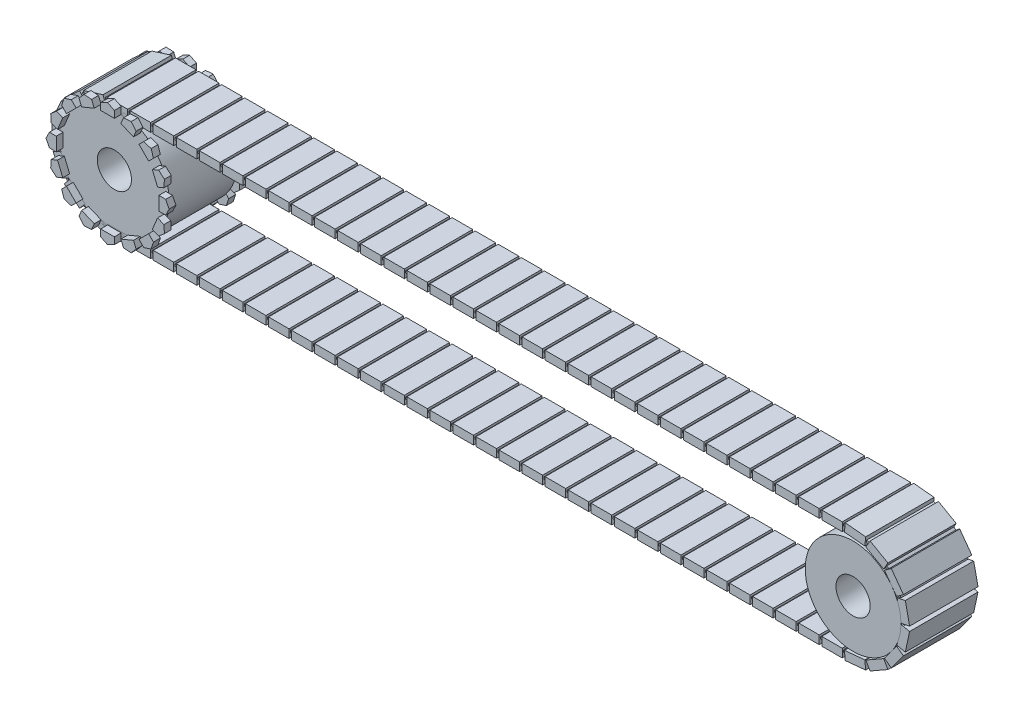
from build123d import *

# Parameters (mm, degrees)
SKETCH1_R             = 40
BOSS_EXTRUDE1_DEPTH   = 50
SKETCH1_R_2           = 35
BOSS_EXTRUDE1_2_DEPTH = 50
BOSS_EXTRUDE2_DEPTH   = 5
CIRPATTERN1_COUNT     = 16
MIRROR1_COPY_1_DEPTH  = 5
MIRROR1_COPY_2_DEPTH  = 5
MIRROR1_COPY_3_DEPTH  = 5
MIRROR1_COPY_4_DEPTH  = 5
MIRROR1_COPY_5_DEPTH  = 5
MIRROR1_COPY_6_DEPTH  = 5
MIRROR1_COPY_7_DEPTH  = 5
MIRROR1_COPY_8_DEPTH  = 5
MIRROR1_COPY_9_DEPTH  = 5
MIRROR1_COPY_10_DEPTH = 5
MIRROR1_COPY_11_DEPTH = 5
MIRROR1_COPY_12_DEPTH = 5
MIRROR1_COPY_13_DEPTH = 5
MIRROR1_COPY_14_DEPTH = 5
MIRROR1_COPY_15_DEPTH = 5
SKETCH10_W            = 6.209415886
SKETCH10_H            = 15
BOSS_EXTRUDE3_DEPTH   = 50
CRVPATTERN3_OUTLINE_W = 15
CRVPATTERN3_OUTLINE_H = 6.209415886
CRVPATTERN3_DEPTH     = 50
BOSS_EXTRUDE4_DEPTH   = 49
CRVPATTERN4_DEPTH     = 49
SKETCH12_R            = 12.5
CUT_EXTRUDE1_DEPTH    = 586.652227204
SKETCH14_R            = 12.5
CUT_EXTRUDE2_DEPTH    = 586.652227204


# Read off the part's stored shape, not the designer's step: CrvPattern3, CrvPattern4
with BuildPart() as part:
    # Sketch1 → Boss-Extrude1 (new body)
    with BuildSketch(Plane.XY):
        Circle(SKETCH1_R)
    extrude(amount=BOSS_EXTRUDE1_DEPTH)

    # Sketch2 → Boss-Extrude2 (add)
    with BuildSketch(Plane.XY.offset(50)):
        Polygon((5, 37.5), (-5, 37.5), (-5, 42.5), (0, 45), (5, 42.5), align=None)
    boss_extrude2 = extrude(amount=BOSS_EXTRUDE2_DEPTH)

    # CirPattern1: Boss-Extrude2 ×16 about axis
    cirpattern1_axis = Axis((0, 0, 0), (0, 0, 1))
    for i in range(1, CIRPATTERN1_COUNT):
        add(boss_extrude2.rotate(cirpattern1_axis, i * 360 / CIRPATTERN1_COUNT))

    # Mirror1: Boss-Extrude2 across plane
    add(boss_extrude2.mirror(Plane.XY.offset(25)))

    # Mirror1 copy 1 sketch → Mirror1 copy 1 (add)
    with BuildSketch(Plane(origin=(0, 0, 0), x_dir=(0.9238795325112867, 0.3826834323650898, 0), z_dir=(0, 0, -1))):
        Polygon((5, -37.5), (-5, -37.5), (-5, -42.5), (0, -45), (5, -42.5), align=None)
    extrude(amount=MIRROR1_COPY_1_DEPTH)

    # Mirror1 copy 2 sketch → Mirror1 copy 2 (add)
    with BuildSketch(Plane(origin=(0, 0, 0), x_dir=(0.7071067811865476, 0.7071067811865475, 0), z_dir=(0, 0, -1))):
        Polygon((5, -37.5), (-5, -37.5), (-5, -42.5), (0, -45), (5, -42.5), align=None)
    extrude(amount=MIRROR1_COPY_2_DEPTH)

    # Mirror1 copy 3 sketch → Mirror1 copy 3 (add)
    with BuildSketch(Plane(origin=(0, 0, 0), x_dir=(0.38268343236508984, 0.9238795325112867, 0), z_dir=(0, 0, -1))):
        Polygon((5, -37.5), (-5, -37.5), (-5, -42.5), (0, -45), (5, -42.5), align=None)
    extrude(amount=MIRROR1_COPY_3_DEPTH)

    # Mirror1 copy 4 sketch → Mirror1 copy 4 (add)
    with BuildSketch(Plane.YX):
        Polygon((5, -37.5), (-5, -37.5), (-5, -42.5), (0, -45), (5, -42.5), align=None)
    extrude(amount=MIRROR1_COPY_4_DEPTH)

    # Mirror1 copy 5 sketch → Mirror1 copy 5 (add)
    with BuildSketch(Plane(origin=(0, 0, 0), x_dir=(-0.3826834323650897, 0.9238795325112867, 0), z_dir=(0, 0, -1))):
        Polygon((5, -37.5), (-5, -37.5), (-5, -42.5), (0, -45), (5, -42.5), align=None)
    extrude(amount=MIRROR1_COPY_5_DEPTH)

    # Mirror1 copy 6 sketch → Mirror1 copy 6 (add)
    with BuildSketch(Plane(origin=(0, 0, 0), x_dir=(-0.7071067811865475, 0.7071067811865476, 0), z_dir=(0, 0, -1))):
        Polygon((5, -37.5), (-5, -37.5), (-5, -42.5), (0, -45), (5, -42.5), align=None)
    extrude(amount=MIRROR1_COPY_6_DEPTH)

    # Mirror1 copy 7 sketch → Mirror1 copy 7 (add)
    with BuildSketch(Plane(origin=(0, 0, 0), x_dir=(-0.9238795325112867, 0.3826834323650899, 0), z_dir=(0, 0, -1))):
        Polygon((5, -37.5), (-5, -37.5), (-5, -42.5), (0, -45), (5, -42.5), align=None)
    extrude(amount=MIRROR1_COPY_7_DEPTH)

    # Mirror1 copy 8 sketch → Mirror1 copy 8 (add)
    with BuildSketch(Plane(origin=(0, 0, 0), x_dir=(-1, 0, 0), z_dir=(0, 0, -1))):
        Polygon((5, -37.5), (-5, -37.5), (-5, -42.5), (0, -45), (5, -42.5), align=None)
    extrude(amount=MIRROR1_COPY_8_DEPTH)

    # Mirror1 copy 9 sketch → Mirror1 copy 9 (add)
    with BuildSketch(Plane(origin=(0, 0, 0), x_dir=(-0.9238795325112868, -0.38268343236508967, 0), z_dir=(0, 0, -1))):
        Polygon((5, -37.5), (-5, -37.5), (-5, -42.5), (0, -45), (5, -42.5), align=None)
    extrude(amount=MIRROR1_COPY_9_DEPTH)

    # Mirror1 copy 10 sketch → Mirror1 copy 10 (add)
    with BuildSketch(Plane(origin=(0, 0, 0), x_dir=(-0.7071067811865477, -0.7071067811865475, 0), z_dir=(0, 0, -1))):
        Polygon((5, -37.5), (-5, -37.5), (-5, -42.5), (0, -45), (5, -42.5), align=None)
    extrude(amount=MIRROR1_COPY_10_DEPTH)

    # Mirror1 copy 11 sketch → Mirror1 copy 11 (add)
    with BuildSketch(Plane(origin=(0, 0, 0), x_dir=(-0.3826834323650895, -0.9238795325112868, 0), z_dir=(0, 0, -1))):
        Polygon((5, -37.5), (-5, -37.5), (-5, -42.5), (0, -45), (5, -42.5), align=None)
    extrude(amount=MIRROR1_COPY_11_DEPTH)

    # Mirror1 copy 12 sketch → Mirror1 copy 12 (add)
    with BuildSketch(Plane(origin=(0, 0, 0), x_dir=(0, -1, 0), z_dir=(0, 0, -1))):
        Polygon((5, -37.5), (-5, -37.5), (-5, -42.5), (0, -45), (5, -42.5), align=None)
    extrude(amount=MIRROR1_COPY_12_DEPTH)

    # Mirror1 copy 13 sketch → Mirror1 copy 13 (add)
    with BuildSketch(Plane(origin=(0, 0, 0), x_dir=(0.38268343236509, -0.9238795325112866, 0), z_dir=(0, 0, -1))):
        Polygon((5, -37.5), (-5, -37.5), (-5, -42.5), (0, -45), (5, -42.5), align=None)
    extrude(amount=MIRROR1_COPY_13_DEPTH)

    # Mirror1 copy 14 sketch → Mirror1 copy 14 (add)
    with BuildSketch(Plane(origin=(0, 0, 0), x_dir=(0.7071067811865474, -0.7071067811865477, 0), z_dir=(0, 0, -1))):
        Polygon((5, -37.5), (-5, -37.5), (-5, -42.5), (0, -45), (5, -42.5), align=None)
    extrude(amount=MIRROR1_COPY_14_DEPTH)

    # Mirror1 copy 15 sketch → Mirror1 copy 15 (add)
    with BuildSketch(Plane(origin=(0, 0, 0), x_dir=(0.9238795325112868, -0.38268343236508956, 0), z_dir=(0, 0, -1))):
        Polygon((5, -37.5), (-5, -37.5), (-5, -42.5), (0, -45), (5, -42.5), align=None)
    extrude(amount=MIRROR1_COPY_15_DEPTH)

    # Sketch12 → Cut-Extrude1 (cut, through all)
    with BuildSketch(Plane.XY.offset(50)):
        Circle(SKETCH12_R)
    extrude(amount=-CUT_EXTRUDE1_DEPTH, mode=Mode.SUBTRACT)


with BuildPart() as body_2:
    # Sketch1 → Boss-Extrude1 2 (new body)
    with BuildSketch(Plane.XY):
        with Locations((540, 0)):
            Circle(SKETCH1_R_2)
    extrude(amount=BOSS_EXTRUDE1_2_DEPTH)

    # Sketch14 → Cut-Extrude2 (cut, through all)
    with BuildSketch(Plane.XY.offset(50)):
        with Locations((540, 0)):
            Circle(SKETCH14_R)
    extrude(amount=-CUT_EXTRUDE2_DEPTH, mode=Mode.SUBTRACT)


with BuildPart() as body_3:
    # Sketch10 → Boss-Extrude3 (new body)
    with BuildSketch(Plane.XY.offset(50)):
        with Locations((-42.395292057, 0)):
            Rectangle(SKETCH10_W, SKETCH10_H)
    extrude(amount=-BOSS_EXTRUDE3_DEPTH)


with BuildPart() as body_4:
    # CrvPattern3 outline → CrvPattern3 (new body)
    with BuildSketch(Plane.XY):
        Polygon((-44.797878774, -10.783621218), (-38.663587828, -24.471954739), (-32.997150786, -21.932597162), (-39.131441732, -8.244263641), align=None)
        Polygon((-36.680017333, -27.181307172), (-25.484254615, -37.164037117), (-21.351793154, -32.529427325), (-32.547555873, -22.54669738), align=None)
        Polygon((-22.566139242, -38.825285198), (-8.266918973, -43.356543269), (-6.391154583, -37.437222902), (-20.690374852, -32.905964832), align=None)
        with Locations((2.181837772, -40)):
            Rectangle(CRVPATTERN3_OUTLINE_W, CRVPATTERN3_OUTLINE_H)
        with Locations((2.181837772, 40)):
            Rectangle(CRVPATTERN3_OUTLINE_W, CRVPATTERN3_OUTLINE_H)
        with Locations((19.034083497, -40)):
            Rectangle(CRVPATTERN3_OUTLINE_W, CRVPATTERN3_OUTLINE_H)
        with Locations((35.886329222, -40)):
            Rectangle(CRVPATTERN3_OUTLINE_W, CRVPATTERN3_OUTLINE_H)
        with Locations((52.738574947, -40)):
            Rectangle(CRVPATTERN3_OUTLINE_W, CRVPATTERN3_OUTLINE_H)
        with Locations((69.590820673, -40)):
            Rectangle(CRVPATTERN3_OUTLINE_W, CRVPATTERN3_OUTLINE_H)
        with Locations((86.443066398, -40)):
            Rectangle(CRVPATTERN3_OUTLINE_W, CRVPATTERN3_OUTLINE_H)
        with Locations((103.295312123, -40)):
            Rectangle(CRVPATTERN3_OUTLINE_W, CRVPATTERN3_OUTLINE_H)
        with Locations((120.147557848, -40)):
            Rectangle(CRVPATTERN3_OUTLINE_W, CRVPATTERN3_OUTLINE_H)
        with Locations((136.999803573, -40)):
            Rectangle(CRVPATTERN3_OUTLINE_W, CRVPATTERN3_OUTLINE_H)
        with Locations((153.852049298, -40)):
            Rectangle(CRVPATTERN3_OUTLINE_W, CRVPATTERN3_OUTLINE_H)
        with Locations((170.704295023, -40)):
            Rectangle(CRVPATTERN3_OUTLINE_W, CRVPATTERN3_OUTLINE_H)
        with Locations((187.556540749, -40)):
            Rectangle(CRVPATTERN3_OUTLINE_W, CRVPATTERN3_OUTLINE_H)
        with Locations((204.408786474, -40)):
            Rectangle(CRVPATTERN3_OUTLINE_W, CRVPATTERN3_OUTLINE_H)
        with Locations((221.261032199, -40)):
            Rectangle(CRVPATTERN3_OUTLINE_W, CRVPATTERN3_OUTLINE_H)
        with Locations((238.113277924, -40)):
            Rectangle(CRVPATTERN3_OUTLINE_W, CRVPATTERN3_OUTLINE_H)
        with Locations((254.965523649, -40)):
            Rectangle(CRVPATTERN3_OUTLINE_W, CRVPATTERN3_OUTLINE_H)
        with Locations((271.817769374, -40)):
            Rectangle(CRVPATTERN3_OUTLINE_W, CRVPATTERN3_OUTLINE_H)
        with Locations((288.6700151, -40)):
            Rectangle(CRVPATTERN3_OUTLINE_W, CRVPATTERN3_OUTLINE_H)
        with Locations((305.522260825, -40)):
            Rectangle(CRVPATTERN3_OUTLINE_W, CRVPATTERN3_OUTLINE_H)
        with Locations((322.37450655, -40)):
            Rectangle(CRVPATTERN3_OUTLINE_W, CRVPATTERN3_OUTLINE_H)
        with Locations((339.226752275, -40)):
            Rectangle(CRVPATTERN3_OUTLINE_W, CRVPATTERN3_OUTLINE_H)
        with Locations((356.078998, -40)):
            Rectangle(CRVPATTERN3_OUTLINE_W, CRVPATTERN3_OUTLINE_H)
        with Locations((372.931243725, -40)):
            Rectangle(CRVPATTERN3_OUTLINE_W, CRVPATTERN3_OUTLINE_H)
        with Locations((389.78348945, -40)):
            Rectangle(CRVPATTERN3_OUTLINE_W, CRVPATTERN3_OUTLINE_H)
        with Locations((406.635735176, -40)):
            Rectangle(CRVPATTERN3_OUTLINE_W, CRVPATTERN3_OUTLINE_H)
        with Locations((423.487980901, -40)):
            Rectangle(CRVPATTERN3_OUTLINE_W, CRVPATTERN3_OUTLINE_H)
        with Locations((440.340226626, -40)):
            Rectangle(CRVPATTERN3_OUTLINE_W, CRVPATTERN3_OUTLINE_H)
        with Locations((457.192472351, -40)):
            Rectangle(CRVPATTERN3_OUTLINE_W, CRVPATTERN3_OUTLINE_H)
        with Locations((474.044718076, -40)):
            Rectangle(CRVPATTERN3_OUTLINE_W, CRVPATTERN3_OUTLINE_H)
        with Locations((490.896963801, -40)):
            Rectangle(CRVPATTERN3_OUTLINE_W, CRVPATTERN3_OUTLINE_H)
        with Locations((507.749209527, -40)):
            Rectangle(CRVPATTERN3_OUTLINE_W, CRVPATTERN3_OUTLINE_H)
        with Locations((524.601455252, -40)):
            Rectangle(CRVPATTERN3_OUTLINE_W, CRVPATTERN3_OUTLINE_H)
        with Locations((19.034083497, 40)):
            Rectangle(CRVPATTERN3_OUTLINE_W, CRVPATTERN3_OUTLINE_H)
        with Locations((35.886329222, 40)):
            Rectangle(CRVPATTERN3_OUTLINE_W, CRVPATTERN3_OUTLINE_H)
        with Locations((52.738574947, 40)):
            Rectangle(CRVPATTERN3_OUTLINE_W, CRVPATTERN3_OUTLINE_H)
        with Locations((69.590820673, 40)):
            Rectangle(CRVPATTERN3_OUTLINE_W, CRVPATTERN3_OUTLINE_H)
        with Locations((86.443066398, 40)):
            Rectangle(CRVPATTERN3_OUTLINE_W, CRVPATTERN3_OUTLINE_H)
        with Locations((103.295312123, 40)):
            Rectangle(CRVPATTERN3_OUTLINE_W, CRVPATTERN3_OUTLINE_H)
        with Locations((120.147557848, 40)):
            Rectangle(CRVPATTERN3_OUTLINE_W, CRVPATTERN3_OUTLINE_H)
        with Locations((136.999803573, 40)):
            Rectangle(CRVPATTERN3_OUTLINE_W, CRVPATTERN3_OUTLINE_H)
        with Locations((153.852049298, 40)):
            Rectangle(CRVPATTERN3_OUTLINE_W, CRVPATTERN3_OUTLINE_H)
        with Locations((170.704295023, 40)):
            Rectangle(CRVPATTERN3_OUTLINE_W, CRVPATTERN3_OUTLINE_H)
        with Locations((187.556540749, 40)):
            Rectangle(CRVPATTERN3_OUTLINE_W, CRVPATTERN3_OUTLINE_H)
        with Locations((204.408786474, 40)):
            Rectangle(CRVPATTERN3_OUTLINE_W, CRVPATTERN3_OUTLINE_H)
        with Locations((221.261032199, 40)):
            Rectangle(CRVPATTERN3_OUTLINE_W, CRVPATTERN3_OUTLINE_H)
        with Locations((238.113277924, 40)):
            Rectangle(CRVPATTERN3_OUTLINE_W, CRVPATTERN3_OUTLINE_H)
        with Locations((254.965523649, 40)):
            Rectangle(CRVPATTERN3_OUTLINE_W, CRVPATTERN3_OUTLINE_H)
        with Locations((271.817769374, 40)):
            Rectangle(CRVPATTERN3_OUTLINE_W, CRVPATTERN3_OUTLINE_H)
        with Locations((288.6700151, 40)):
            Rectangle(CRVPATTERN3_OUTLINE_W, CRVPATTERN3_OUTLINE_H)
        with Locations((305.522260825, 40)):
            Rectangle(CRVPATTERN3_OUTLINE_W, CRVPATTERN3_OUTLINE_H)
        with Locations((322.37450655, 40)):
            Rectangle(CRVPATTERN3_OUTLINE_W, CRVPATTERN3_OUTLINE_H)
        with Locations((339.226752275, 40)):
            Rectangle(CRVPATTERN3_OUTLINE_W, CRVPATTERN3_OUTLINE_H)
        with Locations((356.078998, 40)):
            Rectangle(CRVPATTERN3_OUTLINE_W, CRVPATTERN3_OUTLINE_H)
        with Locations((372.931243725, 40)):
            Rectangle(CRVPATTERN3_OUTLINE_W, CRVPATTERN3_OUTLINE_H)
        with Locations((389.78348945, 40)):
            Rectangle(CRVPATTERN3_OUTLINE_W, CRVPATTERN3_OUTLINE_H)
        with Locations((406.635735176, 40)):
            Rectangle(CRVPATTERN3_OUTLINE_W, CRVPATTERN3_OUTLINE_H)
        with Locations((423.487980901, 40)):
            Rectangle(CRVPATTERN3_OUTLINE_W, CRVPATTERN3_OUTLINE_H)
        with Locations((440.340226626, 40)):
            Rectangle(CRVPATTERN3_OUTLINE_W, CRVPATTERN3_OUTLINE_H)
        with Locations((457.192472351, 40)):
            Rectangle(CRVPATTERN3_OUTLINE_W, CRVPATTERN3_OUTLINE_H)
        with Locations((474.044718076, 40)):
            Rectangle(CRVPATTERN3_OUTLINE_W, CRVPATTERN3_OUTLINE_H)
        with Locations((490.896963801, 40)):
            Rectangle(CRVPATTERN3_OUTLINE_W, CRVPATTERN3_OUTLINE_H)
        with Locations((507.749209527, 40)):
            Rectangle(CRVPATTERN3_OUTLINE_W, CRVPATTERN3_OUTLINE_H)
        with Locations((524.601455252, 40)):
            Rectangle(CRVPATTERN3_OUTLINE_W, CRVPATTERN3_OUTLINE_H)
        Polygon((534.280748393, -43.625876951), (549.211357831, -42.184730949), (548.614779506, -36.004040053), (533.684170067, -37.445186055), align=None)
        Polygon((552.412331614, -41.170379256), (565.4479818, -33.749339961), (562.375960514, -28.353088404), (549.340310328, -35.774127699), align=None)
        Polygon((567.954226355, -31.514640709), (576.815127239, -19.411565251), (571.804925304, -15.743497337), (562.944024421, -27.846572795), align=None)
        Polygon((578.188328304, -16.347342454), (581.324806996, -1.67892395), (575.252652937, -0.380543908), (572.116174245, -15.048962412), align=None)
        Polygon((581.324806996, 1.67892395), (578.188328304, 16.347342454), (572.116174245, 15.048962412), (575.252652937, 0.380543908), align=None)
        Polygon((576.815127239, 19.411565251), (567.954226355, 31.514640709), (562.944024421, 27.846572795), (571.804925304, 15.743497337), align=None)
        Polygon((565.4479818, 33.749339961), (552.412331614, 41.170379256), (549.340310328, 35.774127699), (562.375960514, 28.353088404), align=None)
        Polygon((549.211357831, 42.184730949), (534.280748393, 43.625876951), (533.684170067, 37.445186055), (548.614779506, 36.004040053), align=None)
        Polygon((-8.266918973, 43.356543269), (-22.566139242, 38.825285198), (-20.690374852, 32.905964832), (-6.391154583, 37.437222902), align=None)
        Polygon((-25.484254615, 37.164037117), (-36.680017333, 27.181307172), (-32.547555873, 22.54669738), (-21.351793154, 32.529427325), align=None)
        Polygon((-38.663587828, 24.471954739), (-44.797878774, 10.783621218), (-39.131441732, 8.244263641), (-32.997150786, 21.932597162), align=None)
    extrude(amount=CRVPATTERN3_DEPTH)


with BuildPart() as body_5:
    # Sketch11 → Boss-Extrude4 (new body)
    with BuildSketch(Plane.XY):
        with BuildLine():
            Line((-44.71136477, 5.295440464), (-43.334392114, 12.217949476))
            ThreePointArc((-43.334392114, 12.217949476), (-42.452485412, 12.807220695), (-41.863214193, 11.925313993))
            Line((-41.863214193, 11.925313993), (-43.240186849, 5.002804981))
            ThreePointArc((-43.240186849, 5.002804981), (-44.122093551, 4.413533762), (-44.71136477, 5.295440464))
        make_face()
    extrude(amount=BOSS_EXTRUDE4_DEPTH)


with BuildPart() as body_6:
    # CrvPattern4 outline → CrvPattern4 (new body)
    with BuildSketch(Plane.XY):
        with BuildLine():
            ThreePointArc((-42.991925199, -11.723241454), (-42.093524314, -12.287046252), (-41.529719516, -11.388645367))
            Line((-41.529719516, -11.388645367), (-43.104134409, -4.508354497))
            ThreePointArc((-43.104134409, -4.508354497), (-44.002535294, -3.944549699), (-44.566340092, -4.842950584))
            Line((-44.566340092, -4.842950584), (-42.991925199, -11.723241454))
        make_face()
        with BuildLine():
            ThreePointArc((-34.463004617, -26.550564894), (-33.412594376, -26.697664607), (-33.265494663, -25.647254366))
            Line((-33.265494663, -25.647254366), (-37.515949473, -20.01246789))
            ThreePointArc((-37.515949473, -20.01246789), (-38.566359714, -19.865368177), (-38.713459427, -20.915778418))
            Line((-38.713459427, -20.915778418), (-34.463004617, -26.550564894))
        make_face()
        with BuildLine():
            ThreePointArc((-20.616216255, -36.593396105), (-19.597501711, -36.298064632), (-19.892833184, -35.279350088))
            Line((-19.892833184, -35.279350088), (-26.075970699, -31.875529412))
            ThreePointArc((-26.075970699, -31.875529412), (-27.094685242, -32.170860886), (-26.799353769, -33.189575429))
            Line((-26.799353769, -33.189575429), (-20.616216255, -36.593396105))
        make_face()
        with BuildLine():
            ThreePointArc((-3.873209197, -40.095355747), (-3.06435218, -39.409243273), (-3.750464654, -38.600386256))
            Line((-3.750464654, -38.600386256), (-10.784922978, -38.02282171))
            ThreePointArc((-10.784922978, -38.02282171), (-11.593779995, -38.708934184), (-10.907667521, -39.517791201))
            Line((-10.907667521, -39.517791201), (-3.873209197, -40.095355747))
        make_face()
        with BuildLine():
            ThreePointArc((13.048580145, -39.943235652), (13.798580145, -39.193235652), (13.048580145, -38.443235652))
            Line((13.048580145, -38.443235652), (5.990451164, -38.443235652))
            ThreePointArc((5.990451164, -38.443235652), (5.240451164, -39.193235652), (5.990451164, -39.943235652))
            Line((5.990451164, -39.943235652), (13.048580145, -39.943235652))
        make_face()
        with BuildLine():
            Line((29.900825871, -38.443235652), (22.842696889, -38.443235652))
            ThreePointArc((22.842696889, -38.443235652), (22.092696889, -39.193235652), (22.842696889, -39.943235652))
            Line((22.842696889, -39.943235652), (29.900825871, -39.943235652))
            ThreePointArc((29.900825871, -39.943235652), (30.650825871, -39.193235652), (29.900825871, -38.443235652))
        make_face()
        with BuildLine():
            Line((46.753071596, -38.443235652), (39.694942614, -38.443235652))
            ThreePointArc((39.694942614, -38.443235652), (38.944942614, -39.193235652), (39.694942614, -39.943235652))
            Line((39.694942614, -39.943235652), (46.753071596, -39.943235652))
            ThreePointArc((46.753071596, -39.943235652), (47.503071596, -39.193235652), (46.753071596, -38.443235652))
        make_face()
        with BuildLine():
            Line((63.605317321, -38.443235652), (56.547188339, -38.443235652))
            ThreePointArc((56.547188339, -38.443235652), (55.797188339, -39.193235652), (56.547188339, -39.943235652))
            Line((56.547188339, -39.943235652), (63.605317321, -39.943235652))
            ThreePointArc((63.605317321, -39.943235652), (64.355317321, -39.193235652), (63.605317321, -38.443235652))
        make_face()
        with BuildLine():
            Line((80.457563046, -38.443235652), (73.399434065, -38.443235652))
            ThreePointArc((73.399434065, -38.443235652), (72.649434065, -39.193235652), (73.399434065, -39.943235652))
            Line((73.399434065, -39.943235652), (80.457563046, -39.943235652))
            ThreePointArc((80.457563046, -39.943235652), (81.207563046, -39.193235652), (80.457563046, -38.443235652))
        make_face()
        with BuildLine():
            Line((97.309808771, -38.443235652), (90.25167979, -38.443235652))
            ThreePointArc((90.25167979, -38.443235652), (89.50167979, -39.193235652), (90.25167979, -39.943235652))
            Line((90.25167979, -39.943235652), (97.309808771, -39.943235652))
            ThreePointArc((97.309808771, -39.943235652), (98.059808771, -39.193235652), (97.309808771, -38.443235652))
        make_face()
        with BuildLine():
            Line((114.162054496, -38.443235652), (107.103925515, -38.443235652))
            ThreePointArc((107.103925515, -38.443235652), (106.353925515, -39.193235652), (107.103925515, -39.943235652))
            Line((107.103925515, -39.943235652), (114.162054496, -39.943235652))
            ThreePointArc((114.162054496, -39.943235652), (114.912054496, -39.193235652), (114.162054496, -38.443235652))
        make_face()
        with BuildLine():
            Line((131.014300221, -38.443235652), (123.95617124, -38.443235652))
            ThreePointArc((123.95617124, -38.443235652), (123.20617124, -39.193235652), (123.95617124, -39.943235652))
            Line((123.95617124, -39.943235652), (131.014300221, -39.943235652))
            ThreePointArc((131.014300221, -39.943235652), (131.764300221, -39.193235652), (131.014300221, -38.443235652))
        make_face()
        with BuildLine():
            Line((147.866545947, -38.443235652), (140.808416965, -38.443235652))
            ThreePointArc((140.808416965, -38.443235652), (140.058416965, -39.193235652), (140.808416965, -39.943235652))
            Line((140.808416965, -39.943235652), (147.866545947, -39.943235652))
            ThreePointArc((147.866545947, -39.943235652), (148.616545947, -39.193235652), (147.866545947, -38.443235652))
        make_face()
        with BuildLine():
            Line((164.718791672, -38.443235652), (157.66066269, -38.443235652))
            ThreePointArc((157.66066269, -38.443235652), (156.91066269, -39.193235652), (157.66066269, -39.943235652))
            Line((157.66066269, -39.943235652), (164.718791672, -39.943235652))
            ThreePointArc((164.718791672, -39.943235652), (165.468791672, -39.193235652), (164.718791672, -38.443235652))
        make_face()
        with BuildLine():
            Line((181.571037397, -38.443235652), (174.512908415, -38.443235652))
            ThreePointArc((174.512908415, -38.443235652), (173.762908415, -39.193235652), (174.512908415, -39.943235652))
            Line((174.512908415, -39.943235652), (181.571037397, -39.943235652))
            ThreePointArc((181.571037397, -39.943235652), (182.321037397, -39.193235652), (181.571037397, -38.443235652))
        make_face()
        with BuildLine():
            Line((198.423283122, -38.443235652), (191.365154141, -38.443235652))
            ThreePointArc((191.365154141, -38.443235652), (190.615154141, -39.193235652), (191.365154141, -39.943235652))
            Line((191.365154141, -39.943235652), (198.423283122, -39.943235652))
            ThreePointArc((198.423283122, -39.943235652), (199.173283122, -39.193235652), (198.423283122, -38.443235652))
        make_face()
        with BuildLine():
            Line((215.275528847, -38.443235652), (208.217399866, -38.443235652))
            ThreePointArc((208.217399866, -38.443235652), (207.467399866, -39.193235652), (208.217399866, -39.943235652))
            Line((208.217399866, -39.943235652), (215.275528847, -39.943235652))
            ThreePointArc((215.275528847, -39.943235652), (216.025528847, -39.193235652), (215.275528847, -38.443235652))
        make_face()
        with BuildLine():
            Line((232.127774572, -38.443235652), (225.069645591, -38.443235652))
            ThreePointArc((225.069645591, -38.443235652), (224.319645591, -39.193235652), (225.069645591, -39.943235652))
            Line((225.069645591, -39.943235652), (232.127774572, -39.943235652))
            ThreePointArc((232.127774572, -39.943235652), (232.877774572, -39.193235652), (232.127774572, -38.443235652))
        make_face()
        with BuildLine():
            Line((248.980020298, -38.443235652), (241.921891316, -38.443235652))
            ThreePointArc((241.921891316, -38.443235652), (241.171891316, -39.193235652), (241.921891316, -39.943235652))
            Line((241.921891316, -39.943235652), (248.980020298, -39.943235652))
            ThreePointArc((248.980020298, -39.943235652), (249.730020298, -39.193235652), (248.980020298, -38.443235652))
        make_face()
        with BuildLine():
            Line((265.832266023, -38.443235652), (258.774137041, -38.443235652))
            ThreePointArc((258.774137041, -38.443235652), (258.024137041, -39.193235652), (258.774137041, -39.943235652))
            Line((258.774137041, -39.943235652), (265.832266023, -39.943235652))
            ThreePointArc((265.832266023, -39.943235652), (266.582266023, -39.193235652), (265.832266023, -38.443235652))
        make_face()
        with BuildLine():
            Line((282.684511748, -38.443235652), (275.626382766, -38.443235652))
            ThreePointArc((275.626382766, -38.443235652), (274.876382766, -39.193235652), (275.626382766, -39.943235652))
            Line((275.626382766, -39.943235652), (282.684511748, -39.943235652))
            ThreePointArc((282.684511748, -39.943235652), (283.434511748, -39.193235652), (282.684511748, -38.443235652))
        make_face()
        with BuildLine():
            Line((299.536757473, -38.443235652), (292.478628492, -38.443235652))
            ThreePointArc((292.478628492, -38.443235652), (291.728628492, -39.193235652), (292.478628492, -39.943235652))
            Line((292.478628492, -39.943235652), (299.536757473, -39.943235652))
            ThreePointArc((299.536757473, -39.943235652), (300.286757473, -39.193235652), (299.536757473, -38.443235652))
        make_face()
        with BuildLine():
            Line((316.389003198, -38.443235652), (309.330874217, -38.443235652))
            ThreePointArc((309.330874217, -38.443235652), (308.580874217, -39.193235652), (309.330874217, -39.943235652))
            Line((309.330874217, -39.943235652), (316.389003198, -39.943235652))
            ThreePointArc((316.389003198, -39.943235652), (317.139003198, -39.193235652), (316.389003198, -38.443235652))
        make_face()
        with BuildLine():
            Line((333.241248923, -38.443235652), (326.183119942, -38.443235652))
            ThreePointArc((326.183119942, -38.443235652), (325.433119942, -39.193235652), (326.183119942, -39.943235652))
            Line((326.183119942, -39.943235652), (333.241248923, -39.943235652))
            ThreePointArc((333.241248923, -39.943235652), (333.991248923, -39.193235652), (333.241248923, -38.443235652))
        make_face()
        with BuildLine():
            Line((350.093494648, -38.443235652), (343.035365667, -38.443235652))
            ThreePointArc((343.035365667, -38.443235652), (342.285365667, -39.193235652), (343.035365667, -39.943235652))
            Line((343.035365667, -39.943235652), (350.093494648, -39.943235652))
            ThreePointArc((350.093494648, -39.943235652), (350.843494648, -39.193235652), (350.093494648, -38.443235652))
        make_face()
        with BuildLine():
            Line((366.945740374, -38.443235652), (359.887611392, -38.443235652))
            ThreePointArc((359.887611392, -38.443235652), (359.137611392, -39.193235652), (359.887611392, -39.943235652))
            Line((359.887611392, -39.943235652), (366.945740374, -39.943235652))
            ThreePointArc((366.945740374, -39.943235652), (367.695740374, -39.193235652), (366.945740374, -38.443235652))
        make_face()
        with BuildLine():
            Line((383.797986099, -38.443235652), (376.739857117, -38.443235652))
            ThreePointArc((376.739857117, -38.443235652), (375.989857117, -39.193235652), (376.739857117, -39.943235652))
            Line((376.739857117, -39.943235652), (383.797986099, -39.943235652))
            ThreePointArc((383.797986099, -39.943235652), (384.547986099, -39.193235652), (383.797986099, -38.443235652))
        make_face()
        with BuildLine():
            Line((400.650231824, -38.443235652), (393.592102842, -38.443235652))
            ThreePointArc((393.592102842, -38.443235652), (392.842102842, -39.193235652), (393.592102842, -39.943235652))
            Line((393.592102842, -39.943235652), (400.650231824, -39.943235652))
            ThreePointArc((400.650231824, -39.943235652), (401.400231824, -39.193235652), (400.650231824, -38.443235652))
        make_face()
        with BuildLine():
            Line((417.502477549, -38.443235652), (410.444348568, -38.443235652))
            ThreePointArc((410.444348568, -38.443235652), (409.694348568, -39.193235652), (410.444348568, -39.943235652))
            Line((410.444348568, -39.943235652), (417.502477549, -39.943235652))
            ThreePointArc((417.502477549, -39.943235652), (418.252477549, -39.193235652), (417.502477549, -38.443235652))
        make_face()
        with BuildLine():
            Line((434.354723274, -38.443235652), (427.296594293, -38.443235652))
            ThreePointArc((427.296594293, -38.443235652), (426.546594293, -39.193235652), (427.296594293, -39.943235652))
            Line((427.296594293, -39.943235652), (434.354723274, -39.943235652))
            ThreePointArc((434.354723274, -39.943235652), (435.104723274, -39.193235652), (434.354723274, -38.443235652))
        make_face()
        with BuildLine():
            Line((451.206968999, -38.443235652), (444.148840018, -38.443235652))
            ThreePointArc((444.148840018, -38.443235652), (443.398840018, -39.193235652), (444.148840018, -39.943235652))
            Line((444.148840018, -39.943235652), (451.206968999, -39.943235652))
            ThreePointArc((451.206968999, -39.943235652), (451.956968999, -39.193235652), (451.206968999, -38.443235652))
        make_face()
        with BuildLine():
            Line((468.059214725, -38.443235652), (461.001085743, -38.443235652))
            ThreePointArc((461.001085743, -38.443235652), (460.251085743, -39.193235652), (461.001085743, -39.943235652))
            Line((461.001085743, -39.943235652), (468.059214725, -39.943235652))
            ThreePointArc((468.059214725, -39.943235652), (468.809214725, -39.193235652), (468.059214725, -38.443235652))
        make_face()
        with BuildLine():
            Line((484.91146045, -38.443235652), (477.853331468, -38.443235652))
            ThreePointArc((477.853331468, -38.443235652), (477.103331468, -39.193235652), (477.853331468, -39.943235652))
            Line((477.853331468, -39.943235652), (484.91146045, -39.943235652))
            ThreePointArc((484.91146045, -39.943235652), (485.66146045, -39.193235652), (484.91146045, -38.443235652))
        make_face()
        with BuildLine():
            Line((501.763706175, -38.443235652), (494.705577193, -38.443235652))
            ThreePointArc((494.705577193, -38.443235652), (493.955577193, -39.193235652), (494.705577193, -39.943235652))
            Line((494.705577193, -39.943235652), (501.763706175, -39.943235652))
            ThreePointArc((501.763706175, -39.943235652), (502.513706175, -39.193235652), (501.763706175, -38.443235652))
        make_face()
        with BuildLine():
            Line((518.6159519, -38.443235652), (511.557822919, -38.443235652))
            ThreePointArc((511.557822919, -38.443235652), (510.807822919, -39.193235652), (511.557822919, -39.943235652))
            Line((511.557822919, -39.943235652), (518.6159519, -39.943235652))
            ThreePointArc((518.6159519, -39.943235652), (519.3659519, -39.193235652), (518.6159519, -38.443235652))
        make_face()
        with BuildLine():
            Line((535.468197625, -38.443235652), (528.410068644, -38.443235652))
            ThreePointArc((528.410068644, -38.443235652), (527.660068644, -39.193235652), (528.410068644, -39.943235652))
            Line((528.410068644, -39.943235652), (535.468197625, -39.943235652))
            ThreePointArc((535.468197625, -39.943235652), (536.218197625, -39.193235652), (535.468197625, -38.443235652))
        make_face()
        with BuildLine():
            ThreePointArc((552.156998486, -36.745325123), (552.631879979, -35.796911939), (551.683466795, -35.322030446))
            Line((551.683466795, -35.322030446), (544.986268523, -37.550195616))
            ThreePointArc((544.986268523, -37.550195616), (544.51138703, -38.4986088), (545.459800214, -38.973490293))
            Line((545.459800214, -38.973490293), (552.156998486, -36.745325123))
        make_face()
        with BuildLine():
            ThreePointArc((566.096302185, -26.831303788), (566.141801775, -25.771619973), (565.08211796, -25.726120383))
            Line((565.08211796, -25.726120383), (559.881766615, -30.49828243))
            ThreePointArc((559.881766615, -30.49828243), (559.836267025, -31.557966245), (560.89595084, -31.603465835))
            Line((560.89595084, -31.603465835), (566.096302185, -26.831303788))
        make_face()
        with BuildLine():
            ThreePointArc((574.762325303, -12.083692117), (574.370485619, -11.09806457), (573.384858072, -11.489904255))
            Line((573.384858072, -11.489904255), (570.590837192, -17.971465181))
            ThreePointArc((570.590837192, -17.971465181), (570.982676876, -18.957092728), (571.968304423, -18.565253043))
            Line((571.968304423, -18.565253043), (574.762325303, -12.083692117))
        make_face()
        with BuildLine():
            ThreePointArc((576.639476903, 4.918316839), (575.878826341, 5.657512836), (575.139630344, 4.896862274))
            Line((575.139630344, 4.896862274), (575.240583066, -2.160544705))
            ThreePointArc((575.240583066, -2.160544705), (576.001233628, -2.899740702), (576.740429625, -2.13909014))
            Line((576.740429625, -2.13909014), (576.639476903, 4.918316839))
        make_face()
        with BuildLine():
            ThreePointArc((571.399464074, 21.201261051), (570.403031947, 21.564748351), (570.039544648, 20.568316224))
            Line((570.039544648, 20.568316224), (573.017815465, 14.169325081))
            ThreePointArc((573.017815465, 14.169325081), (574.014247592, 13.805837781), (574.377734892, 14.802269908))
            Line((574.377734892, 14.802269908), (571.399464074, 21.201261051))
        make_face()
        with BuildLine():
            ThreePointArc((559.958706706, 33.917434906), (558.900757897, 33.841643627), (558.976549176, 32.783694818))
            Line((558.976549176, 32.783694818), (564.31127169, 28.162231801))
            ThreePointArc((564.31127169, 28.162231801), (565.369220498, 28.23802308), (565.29342922, 29.295971889))
            Line((565.29342922, 29.295971889), (559.958706706, 33.917434906))
        make_face()
        with BuildLine():
            ThreePointArc((544.318065857, 40.842921206), (543.383623831, 40.3411064), (543.885438638, 39.406664374))
            Line((543.885438638, 39.406664374), (550.643629288, 37.370971899))
            ThreePointArc((550.643629288, 37.370971899), (551.578071314, 37.872786706), (551.076256507, 38.807228732))
            Line((551.076256507, 38.807228732), (544.318065857, 40.842921206))
        make_face()
        with BuildLine():
            ThreePointArc((527.265786186, 41.556764348), (526.515786186, 40.806764348), (527.265786186, 40.056764348))
            Line((527.265786186, 40.056764348), (534.323915168, 40.056764348))
            ThreePointArc((534.323915168, 40.056764348), (535.073915168, 40.806764348), (534.323915168, 41.556764348))
            Line((534.323915168, 41.556764348), (527.265786186, 41.556764348))
        make_face()
        with BuildLine():
            Line((510.413540461, 40.056764348), (517.471669443, 40.056764348))
            ThreePointArc((517.471669443, 40.056764348), (518.221669443, 40.806764348), (517.471669443, 41.556764348))
            Line((517.471669443, 41.556764348), (510.413540461, 41.556764348))
            ThreePointArc((510.413540461, 41.556764348), (509.663540461, 40.806764348), (510.413540461, 40.056764348))
        make_face()
        with BuildLine():
            Line((493.561294736, 40.056764348), (500.619423718, 40.056764348))
            ThreePointArc((500.619423718, 40.056764348), (501.369423718, 40.806764348), (500.619423718, 41.556764348))
            Line((500.619423718, 41.556764348), (493.561294736, 41.556764348))
            ThreePointArc((493.561294736, 41.556764348), (492.811294736, 40.806764348), (493.561294736, 40.056764348))
        make_face()
        with BuildLine():
            Line((476.709049011, 40.056764348), (483.767177992, 40.056764348))
            ThreePointArc((483.767177992, 40.056764348), (484.517177992, 40.806764348), (483.767177992, 41.556764348))
            Line((483.767177992, 41.556764348), (476.709049011, 41.556764348))
            ThreePointArc((476.709049011, 41.556764348), (475.959049011, 40.806764348), (476.709049011, 40.056764348))
        make_face()
        with BuildLine():
            Line((459.856803286, 40.056764348), (466.914932267, 40.056764348))
            ThreePointArc((466.914932267, 40.056764348), (467.664932267, 40.806764348), (466.914932267, 41.556764348))
            Line((466.914932267, 41.556764348), (459.856803286, 41.556764348))
            ThreePointArc((459.856803286, 41.556764348), (459.106803286, 40.806764348), (459.856803286, 40.056764348))
        make_face()
        with BuildLine():
            Line((443.004557561, 40.056764348), (450.062686542, 40.056764348))
            ThreePointArc((450.062686542, 40.056764348), (450.812686542, 40.806764348), (450.062686542, 41.556764348))
            Line((450.062686542, 41.556764348), (443.004557561, 41.556764348))
            ThreePointArc((443.004557561, 41.556764348), (442.254557561, 40.806764348), (443.004557561, 40.056764348))
        make_face()
        with BuildLine():
            Line((426.152311836, 40.056764348), (433.210440817, 40.056764348))
            ThreePointArc((433.210440817, 40.056764348), (433.960440817, 40.806764348), (433.210440817, 41.556764348))
            Line((433.210440817, 41.556764348), (426.152311836, 41.556764348))
            ThreePointArc((426.152311836, 41.556764348), (425.402311836, 40.806764348), (426.152311836, 40.056764348))
        make_face()
        with BuildLine():
            Line((409.30006611, 40.056764348), (416.358195092, 40.056764348))
            ThreePointArc((416.358195092, 40.056764348), (417.108195092, 40.806764348), (416.358195092, 41.556764348))
            Line((416.358195092, 41.556764348), (409.30006611, 41.556764348))
            ThreePointArc((409.30006611, 41.556764348), (408.55006611, 40.806764348), (409.30006611, 40.056764348))
        make_face()
        with BuildLine():
            Line((392.447820385, 40.056764348), (399.505949367, 40.056764348))
            ThreePointArc((399.505949367, 40.056764348), (400.255949367, 40.806764348), (399.505949367, 41.556764348))
            Line((399.505949367, 41.556764348), (392.447820385, 41.556764348))
            ThreePointArc((392.447820385, 41.556764348), (391.697820385, 40.806764348), (392.447820385, 40.056764348))
        make_face()
        with BuildLine():
            Line((375.59557466, 40.056764348), (382.653703642, 40.056764348))
            ThreePointArc((382.653703642, 40.056764348), (383.403703642, 40.806764348), (382.653703642, 41.556764348))
            Line((382.653703642, 41.556764348), (375.59557466, 41.556764348))
            ThreePointArc((375.59557466, 41.556764348), (374.84557466, 40.806764348), (375.59557466, 40.056764348))
        make_face()
        with BuildLine():
            Line((358.743328935, 40.056764348), (365.801457916, 40.056764348))
            ThreePointArc((365.801457916, 40.056764348), (366.551457916, 40.806764348), (365.801457916, 41.556764348))
            Line((365.801457916, 41.556764348), (358.743328935, 41.556764348))
            ThreePointArc((358.743328935, 41.556764348), (357.993328935, 40.806764348), (358.743328935, 40.056764348))
        make_face()
        with BuildLine():
            Line((341.89108321, 40.056764348), (348.949212191, 40.056764348))
            ThreePointArc((348.949212191, 40.056764348), (349.699212191, 40.806764348), (348.949212191, 41.556764348))
            Line((348.949212191, 41.556764348), (341.89108321, 41.556764348))
            ThreePointArc((341.89108321, 41.556764348), (341.14108321, 40.806764348), (341.89108321, 40.056764348))
        make_face()
        with BuildLine():
            Line((325.038837485, 40.056764348), (332.096966466, 40.056764348))
            ThreePointArc((332.096966466, 40.056764348), (332.846966466, 40.806764348), (332.096966466, 41.556764348))
            Line((332.096966466, 41.556764348), (325.038837485, 41.556764348))
            ThreePointArc((325.038837485, 41.556764348), (324.288837485, 40.806764348), (325.038837485, 40.056764348))
        make_face()
        with BuildLine():
            Line((308.186591759, 40.056764348), (315.244720741, 40.056764348))
            ThreePointArc((315.244720741, 40.056764348), (315.994720741, 40.806764348), (315.244720741, 41.556764348))
            Line((315.244720741, 41.556764348), (308.186591759, 41.556764348))
            ThreePointArc((308.186591759, 41.556764348), (307.436591759, 40.806764348), (308.186591759, 40.056764348))
        make_face()
        with BuildLine():
            Line((291.334346034, 40.056764348), (298.392475016, 40.056764348))
            ThreePointArc((298.392475016, 40.056764348), (299.142475016, 40.806764348), (298.392475016, 41.556764348))
            Line((298.392475016, 41.556764348), (291.334346034, 41.556764348))
            ThreePointArc((291.334346034, 41.556764348), (290.584346034, 40.806764348), (291.334346034, 40.056764348))
        make_face()
        with BuildLine():
            Line((274.482100309, 40.056764348), (281.540229291, 40.056764348))
            ThreePointArc((281.540229291, 40.056764348), (282.290229291, 40.806764348), (281.540229291, 41.556764348))
            Line((281.540229291, 41.556764348), (274.482100309, 41.556764348))
            ThreePointArc((274.482100309, 41.556764348), (273.732100309, 40.806764348), (274.482100309, 40.056764348))
        make_face()
        with BuildLine():
            Line((257.629854584, 40.056764348), (264.687983565, 40.056764348))
            ThreePointArc((264.687983565, 40.056764348), (265.437983565, 40.806764348), (264.687983565, 41.556764348))
            Line((264.687983565, 41.556764348), (257.629854584, 41.556764348))
            ThreePointArc((257.629854584, 41.556764348), (256.879854584, 40.806764348), (257.629854584, 40.056764348))
        make_face()
        with BuildLine():
            Line((240.777608859, 40.056764348), (247.83573784, 40.056764348))
            ThreePointArc((247.83573784, 40.056764348), (248.58573784, 40.806764348), (247.83573784, 41.556764348))
            Line((247.83573784, 41.556764348), (240.777608859, 41.556764348))
            ThreePointArc((240.777608859, 41.556764348), (240.027608859, 40.806764348), (240.777608859, 40.056764348))
        make_face()
        with BuildLine():
            Line((223.925363134, 40.056764348), (230.983492115, 40.056764348))
            ThreePointArc((230.983492115, 40.056764348), (231.733492115, 40.806764348), (230.983492115, 41.556764348))
            Line((230.983492115, 41.556764348), (223.925363134, 41.556764348))
            ThreePointArc((223.925363134, 41.556764348), (223.175363134, 40.806764348), (223.925363134, 40.056764348))
        make_face()
        with BuildLine():
            Line((207.073117409, 40.056764348), (214.13124639, 40.056764348))
            ThreePointArc((214.13124639, 40.056764348), (214.88124639, 40.806764348), (214.13124639, 41.556764348))
            Line((214.13124639, 41.556764348), (207.073117409, 41.556764348))
            ThreePointArc((207.073117409, 41.556764348), (206.323117409, 40.806764348), (207.073117409, 40.056764348))
        make_face()
        with BuildLine():
            Line((190.220871683, 40.056764348), (197.279000665, 40.056764348))
            ThreePointArc((197.279000665, 40.056764348), (198.029000665, 40.806764348), (197.279000665, 41.556764348))
            Line((197.279000665, 41.556764348), (190.220871683, 41.556764348))
            ThreePointArc((190.220871683, 41.556764348), (189.470871683, 40.806764348), (190.220871683, 40.056764348))
        make_face()
        with BuildLine():
            Line((173.368625958, 40.056764348), (180.42675494, 40.056764348))
            ThreePointArc((180.42675494, 40.056764348), (181.17675494, 40.806764348), (180.42675494, 41.556764348))
            Line((180.42675494, 41.556764348), (173.368625958, 41.556764348))
            ThreePointArc((173.368625958, 41.556764348), (172.618625958, 40.806764348), (173.368625958, 40.056764348))
        make_face()
        with BuildLine():
            Line((156.516380233, 40.056764348), (163.574509215, 40.056764348))
            ThreePointArc((163.574509215, 40.056764348), (164.324509215, 40.806764348), (163.574509215, 41.556764348))
            Line((163.574509215, 41.556764348), (156.516380233, 41.556764348))
            ThreePointArc((156.516380233, 41.556764348), (155.766380233, 40.806764348), (156.516380233, 40.056764348))
        make_face()
        with BuildLine():
            Line((139.664134508, 40.056764348), (146.722263489, 40.056764348))
            ThreePointArc((146.722263489, 40.056764348), (147.472263489, 40.806764348), (146.722263489, 41.556764348))
            Line((146.722263489, 41.556764348), (139.664134508, 41.556764348))
            ThreePointArc((139.664134508, 41.556764348), (138.914134508, 40.806764348), (139.664134508, 40.056764348))
        make_face()
        with BuildLine():
            Line((122.811888783, 40.056764348), (129.870017764, 40.056764348))
            ThreePointArc((129.870017764, 40.056764348), (130.620017764, 40.806764348), (129.870017764, 41.556764348))
            Line((129.870017764, 41.556764348), (122.811888783, 41.556764348))
            ThreePointArc((122.811888783, 41.556764348), (122.061888783, 40.806764348), (122.811888783, 40.056764348))
        make_face()
        with BuildLine():
            Line((105.959643058, 40.056764348), (113.017772039, 40.056764348))
            ThreePointArc((113.017772039, 40.056764348), (113.767772039, 40.806764348), (113.017772039, 41.556764348))
            Line((113.017772039, 41.556764348), (105.959643058, 41.556764348))
            ThreePointArc((105.959643058, 41.556764348), (105.209643058, 40.806764348), (105.959643058, 40.056764348))
        make_face()
        with BuildLine():
            Line((89.107397332, 40.056764348), (96.165526314, 40.056764348))
            ThreePointArc((96.165526314, 40.056764348), (96.915526314, 40.806764348), (96.165526314, 41.556764348))
            Line((96.165526314, 41.556764348), (89.107397332, 41.556764348))
            ThreePointArc((89.107397332, 41.556764348), (88.357397332, 40.806764348), (89.107397332, 40.056764348))
        make_face()
        with BuildLine():
            Line((72.255151607, 40.056764348), (79.313280589, 40.056764348))
            ThreePointArc((79.313280589, 40.056764348), (80.063280589, 40.806764348), (79.313280589, 41.556764348))
            Line((79.313280589, 41.556764348), (72.255151607, 41.556764348))
            ThreePointArc((72.255151607, 41.556764348), (71.505151607, 40.806764348), (72.255151607, 40.056764348))
        make_face()
        with BuildLine():
            Line((55.402905882, 40.056764348), (62.461034864, 40.056764348))
            ThreePointArc((62.461034864, 40.056764348), (63.211034864, 40.806764348), (62.461034864, 41.556764348))
            Line((62.461034864, 41.556764348), (55.402905882, 41.556764348))
            ThreePointArc((55.402905882, 41.556764348), (54.652905882, 40.806764348), (55.402905882, 40.056764348))
        make_face()
        with BuildLine():
            Line((38.550660157, 40.056764348), (45.608789138, 40.056764348))
            ThreePointArc((45.608789138, 40.056764348), (46.358789138, 40.806764348), (45.608789138, 41.556764348))
            Line((45.608789138, 41.556764348), (38.550660157, 41.556764348))
            ThreePointArc((38.550660157, 41.556764348), (37.800660157, 40.806764348), (38.550660157, 40.056764348))
        make_face()
        with BuildLine():
            Line((21.698414432, 40.056764348), (28.756543413, 40.056764348))
            ThreePointArc((28.756543413, 40.056764348), (29.506543413, 40.806764348), (28.756543413, 41.556764348))
            Line((28.756543413, 41.556764348), (21.698414432, 41.556764348))
            ThreePointArc((21.698414432, 41.556764348), (20.948414432, 40.806764348), (21.698414432, 40.056764348))
        make_face()
        with BuildLine():
            Line((4.846168707, 40.056764348), (11.904297688, 40.056764348))
            ThreePointArc((11.904297688, 40.056764348), (12.654297688, 40.806764348), (11.904297688, 41.556764348))
            Line((11.904297688, 41.556764348), (4.846168707, 41.556764348))
            ThreePointArc((4.846168707, 41.556764348), (4.096168707, 40.806764348), (4.846168707, 40.056764348))
        make_face()
        with BuildLine():
            ThreePointArc((-12.058273788, 40.918838117), (-12.72096967, 40.090687062), (-11.892818615, 39.427991181))
            Line((-11.892818615, 39.427991181), (-4.877758639, 40.206527149))
            ThreePointArc((-4.877758639, 40.206527149), (-4.215062758, 41.034678204), (-5.043213813, 41.697374085))
            Line((-5.043213813, 41.697374085), (-12.058273788, 40.918838117))
        make_face()
        with BuildLine():
            ThreePointArc((-27.762450922, 34.138659119), (-28.028523104, 33.111913973), (-27.001777958, 32.845841792))
            Line((-27.001777958, 32.845841792), (-20.918530326, 36.425127051))
            ThreePointArc((-20.918530326, 36.425127051), (-20.652458144, 37.451872196), (-21.679203289, 37.717944378))
            Line((-21.679203289, 37.717944378), (-27.762450922, 34.138659119))
        make_face()
        with BuildLine():
            ThreePointArc((-39.320612497, 21.529102916), (-39.143527919, 20.483329971), (-38.097754974, 20.66041455))
            Line((-38.097754974, 20.66041455), (-34.010211952, 26.414471967))
            ThreePointArc((-34.010211952, 26.414471967), (-34.187296531, 27.460244912), (-35.233069476, 27.283160333))
            Line((-35.233069476, 27.283160333), (-39.320612497, 21.529102916))
        make_face()
    extrude(amount=CRVPATTERN4_DEPTH)


solid = Compound([part.part, body_2.part, body_3.part, body_4.part, body_5.part, body_6.part])
